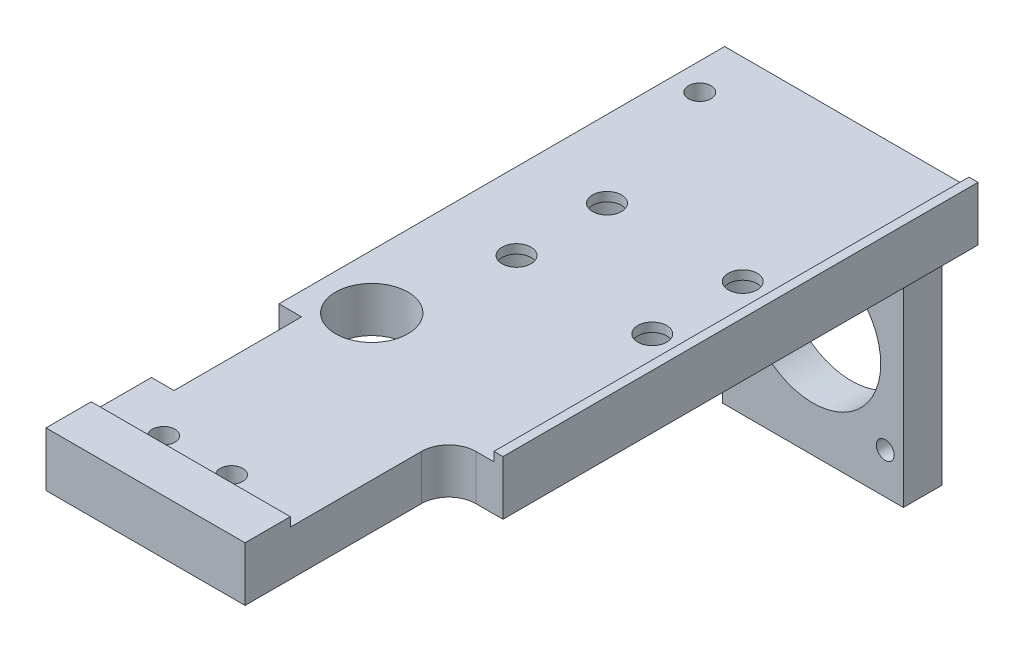
from build123d import *

# Parameters (mm, degrees)
BACK_SKETCH_R                                  = 0.8
BACK_SKETCH_R_2                                = 4
BACK_SKETCH_R_3                                = 1.25
BACK_EXTRUDE_DEPTH                             = 6
BOTTOM_SKETCH_W                                = 20
BOTTOM_SKETCH_H                                = 25
BOTTOM_SKETCH_R                                = 0.989941464
BOTTOM_SKETCH_R_2                              = 7.5
BOTTOM_EXTRUDE_DEPTH                           = 4.25
CARRAIGE_MOUNT_M3S_D                           = 3.2
CARRAIGE_MOUNT_M3S_CBORE_D                     = 6.5
CARRAIGE_MOUNT_M3S_CBORE_DEPTH                 = 4
ROTATIONAL_SENSOR_TAPPED_HOLES_M2_5X0_45_D     = 2.05
ROTATIONAL_SENSOR_TAPPED_HOLES_M2_5X0_45_DEPTH = 4
ROTATIONAL_SENSOR_TAPPED_HOLES_M2_5X0_45_TIP   = 0.615882135
M3X0_5_TAPPED_HOLE1_D                          = 2.5
SKETCH5_W                                      = 27
SKETCH5_H                                      = 70
BACK_RECESS_CUT_DEPTH                          = 1


with BuildPart() as part:
    # Back Sketch → Back Extrude (new body)
    with BuildSketch(Plane(origin=(0, 0, 0), x_dir=(1, 0, 0), z_dir=(0, 1, 0))):
        with BuildLine():
            Line((14, 4.25), (14, -48.25))
            Line((14, -48.25), (11, -48.25))
            ThreePointArc((11, -48.25), (8.878679656, -49.128679656), (8, -51.25))
            Line((8, -51.25), (8, -70.75))
            Line((8, -70.75), (-14, -70.75))
            Line((-14, -70.75), (-14, -59.1))
            Line((-14, -59.1), (-11.5, -59.1))
            Line((-11.5, -59.1), (-11.5, -45))
            Line((-11.5, -45), (-14, -45))
            Line((-14, -45), (-14, 4.25))
            Line((-14, 4.25), (14, 4.25))
        make_face()
        with Locations((9.5, -17.25)):
            Circle(BACK_SKETCH_R, mode=Mode.SUBTRACT)
        with Locations((-5.5, -17.25)):
            Circle(BACK_SKETCH_R, mode=Mode.SUBTRACT)
        with Locations((-5.5, -27.25)):
            Circle(BACK_SKETCH_R, mode=Mode.SUBTRACT)
        with Locations((9.5, -27.25)):
            Circle(BACK_SKETCH_R, mode=Mode.SUBTRACT)
        with Locations((-8, -40.75)):
            Circle(BACK_SKETCH_R_2, mode=Mode.SUBTRACT)
        with Locations((-7.75, -64)):
            Circle(BACK_SKETCH_R_3, mode=Mode.SUBTRACT)
        with Locations((-0.25, -64)):
            Circle(BACK_SKETCH_R_3, mode=Mode.SUBTRACT)
    extrude(amount=BACK_EXTRUDE_DEPTH)

    # Bottom Sketch → Bottom Extrude (add)
    with BuildSketch(Plane.XY):
        with Locations((0, -12.5)):
            Rectangle(BOTTOM_SKETCH_W, BOTTOM_SKETCH_H)
        with Locations((-8, -20.5)):
            Circle(BOTTOM_SKETCH_R, mode=Mode.SUBTRACT)
        with Locations((8, -20.5)):
            Circle(BOTTOM_SKETCH_R, mode=Mode.SUBTRACT)
        with Locations((-8, -4.5)):
            Circle(BOTTOM_SKETCH_R, mode=Mode.SUBTRACT)
        with Locations((0, -12.5)):
            Circle(BOTTOM_SKETCH_R_2, mode=Mode.SUBTRACT)
        with Locations((8, -4.5)):
            Circle(BOTTOM_SKETCH_R, mode=Mode.SUBTRACT)
    extrude(amount=-BOTTOM_EXTRUDE_DEPTH)

    # Carraige Mount  M3s (through all)
    with Locations(Plane(origin=(9.5, 0, 27.25), x_dir=(0, 0, -1), z_dir=(0, -1, 0))):
        with Locations((0, 0), (0, -15), (10, -15), (10, 0)):
            CounterBoreHole(CARRAIGE_MOUNT_M3S_D / 2, CARRAIGE_MOUNT_M3S_CBORE_D / 2, CARRAIGE_MOUNT_M3S_CBORE_DEPTH)

    # Rotational Sensor Tapped Holes M2.5x0.45 Tapped Holes
    with Locations(Plane.ZY.offset(11.5)):
        with Locations((55.25, 3.25), (48.25, 3.25)):
            Hole(ROTATIONAL_SENSOR_TAPPED_HOLES_M2_5X0_45_D / 2, depth=ROTATIONAL_SENSOR_TAPPED_HOLES_M2_5X0_45_DEPTH)
            with Locations((0, 0, -(ROTATIONAL_SENSOR_TAPPED_HOLES_M2_5X0_45_DEPTH + ROTATIONAL_SENSOR_TAPPED_HOLES_M2_5X0_45_TIP / 2))):  # 118° drill point
                Cone(0, ROTATIONAL_SENSOR_TAPPED_HOLES_M2_5X0_45_D / 2, ROTATIONAL_SENSOR_TAPPED_HOLES_M2_5X0_45_TIP, mode=Mode.SUBTRACT)

    # M3x0.5 Tapped Hole1 (through all)
    with Locations(Plane(origin=(0, 6, 0), x_dir=(1, 0, 0), z_dir=(0, 1, 0))):
        with Locations((-11, -1.5)):
            Hole(M3X0_5_TAPPED_HOLE1_D / 2)

    # Sketch5 → Back Recess Cut (cut)
    with BuildSketch(Plane(origin=(0, 6, 0), x_dir=(1, 0, 0), z_dir=(0, 1, 0))):
        with Locations((-0.5, -30.75)):
            Rectangle(SKETCH5_W, SKETCH5_H)
    extrude(amount=-BACK_RECESS_CUT_DEPTH, mode=Mode.SUBTRACT)


solid = part.part
